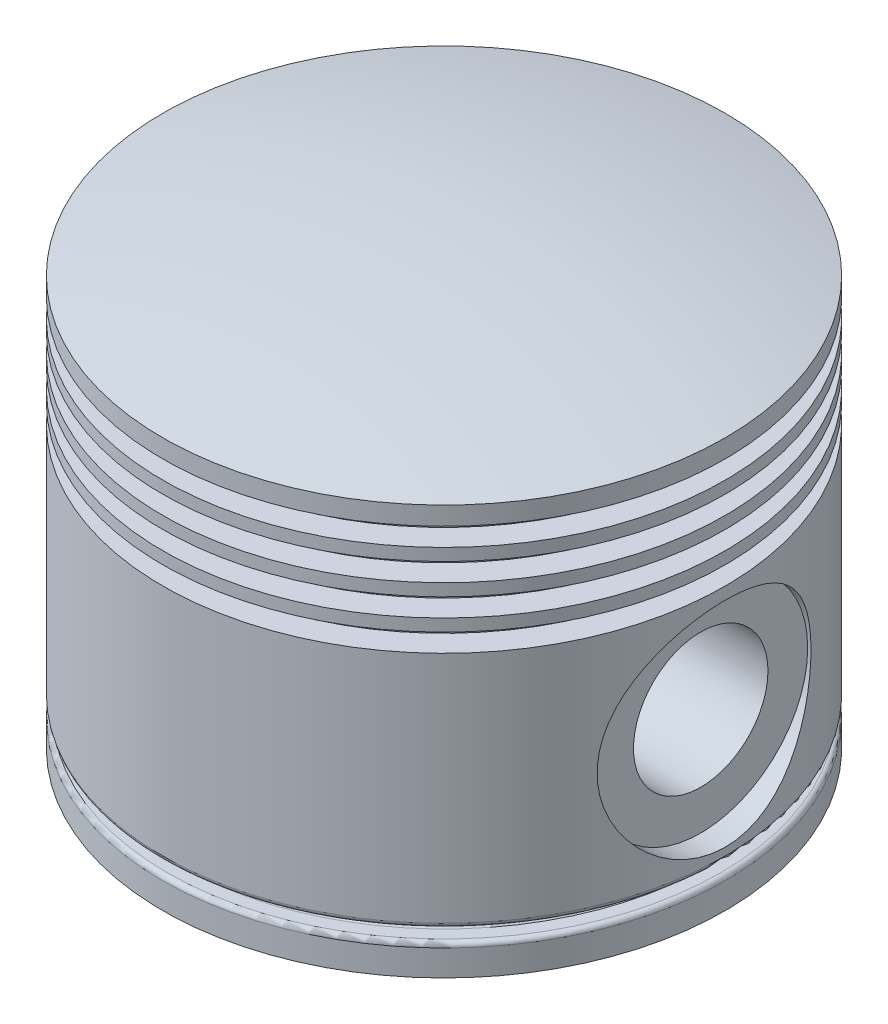
from build123d import *

# Parameters (mm, degrees)
BOSS_EXTRUDE1_REACH                       = 124.544
BOSS_EXTRUDE1_END_RADIUS                  = 37
BOSS_EXTRUDE1_START                       = 25
SKETCH5_R                                 = 19.5
CBORE_START                               = 25
CBORE_FOR_M5_HEX_HEAD_BOLT2_OUTLINE_R     = 11
CBORE_FOR_M5_HEX_HEAD_BOLT2_DEPTH         = 21.000000075
CBORE_START_2                             = 42
CBORE_FOR_M5_HEX_HEAD_BOLT2_2_OUTLINE_R   = 17.5
CBORE_FOR_M5_HEX_HEAD_BOLT2_2_OUTLINE_R_2 = 11
CBORE_FOR_M5_HEX_HEAD_BOLT2_2_DEPTH       = 4.000000075
FILLET1_R                                 = 0.75


# Read off the part's stored shape, not the designer's step: CBORE for M5 Hex Head Bolt2
with BuildPart() as part:
    # Sketch1 → Revolve1 (revolve)
    with BuildSketch(Plane.XY, mode=Mode.PRIVATE) as revolve1_sk:
        with BuildLine():
            Line((0, 72.683334091), (0, 62))
            Line((0, 62), (37, 62))
            Line((37, 62), (37, 0))
            Line((37, 0), (46, 0))
            Line((46, 0), (46, 5))
            Line((46, 5), (42.5, 5))
            Line((42.5, 5), (42.5, 7))
            Line((42.5, 7), (46, 7))
            Line((46, 7), (46, 46))
            Line((46, 46), (42, 46))
            Line((42, 46), (42, 49))
            Line((42, 49), (46, 49))
            Line((46, 49), (46, 51))
            Line((46, 51), (42, 51))
            Line((42, 51), (42, 54))
            Line((42, 54), (46, 54))
            Line((46, 54), (46, 56))
            Line((46, 56), (42, 56))
            Line((42, 56), (42, 59))
            Line((42, 59), (46, 59))
            Line((46, 59), (46, 61))
            Line((46, 61), (42, 61))
            Line((42, 61), (42, 64))
            Line((42, 64), (46, 64))
            Line((46, 64), (46, 67))
            ThreePointArc((46, 67), (23.174880185, 71.257119382), (0, 72.683334091))
        make_face()
    revolve(revolve1_sk.sketch.rotate(Axis((0, 0, 0), (0, 1, 0)), 90), axis=Axis((0, 0, 0), (0, 1, 0)))

    # Boss-Extrude1: up to this cylinder (the profile starts inside it)
    boss_extrude1_end = Plane(origin=(0, 26.5, 0), z_dir=(0, -1, 0)) * Cylinder(BOSS_EXTRUDE1_END_RADIUS, 324.088, mode=Mode.PRIVATE)
    # Sketch5 → Boss-Extrude1 (add, up to the surface)
    with BuildSketch(Plane(origin=(0, 0, 0), x_dir=(0, 0, -1), z_dir=(1, 0, 0)).offset(BOSS_EXTRUDE1_START), mode=Mode.PRIVATE) as boss_extrude1_sk1:
        with Locations(Location((0, 26.5, 0), (0, 0, 180))):
            Circle(SKETCH5_R)
    boss_extrude1_tool1 = extrude(boss_extrude1_sk1.sketch, amount=BOSS_EXTRUDE1_REACH, mode=Mode.PRIVATE) & boss_extrude1_end
    boss_extrude1 = boss_extrude1_tool1.solids().sort_by_distance((25, 26.5, 0))[0]
    add(boss_extrude1)

    # CBORE for M5 Hex Head Bolt2 outline → CBORE for M5 Hex Head Bolt2 (cut)
    with BuildSketch(Plane.YZ.offset(CBORE_START)):
        with Locations((26.5, 0)):
            Circle(CBORE_FOR_M5_HEX_HEAD_BOLT2_OUTLINE_R)
    cbore_for_m5_hex_head_bolt2 = extrude(amount=CBORE_FOR_M5_HEX_HEAD_BOLT2_DEPTH, mode=Mode.SUBTRACT)

    # CBORE for M5 Hex Head Bolt2 2 outline → CBORE for M5 Hex Head Bolt2 2 (cut)
    with BuildSketch(Plane.YZ.offset(CBORE_START_2)):
        with Locations((26.5, 0)):
            Circle(CBORE_FOR_M5_HEX_HEAD_BOLT2_2_OUTLINE_R)
        with Locations((26.5, 0)):
            Circle(CBORE_FOR_M5_HEX_HEAD_BOLT2_2_OUTLINE_R_2, mode=Mode.SUBTRACT)
    cbore_for_m5_hex_head_bolt2_2 = extrude(amount=CBORE_FOR_M5_HEX_HEAD_BOLT2_2_DEPTH, mode=Mode.SUBTRACT)

    # Mirror1: Boss-Extrude1, CBORE for M5 Hex Head Bolt2, CBORE for M5 Hex Head Bolt2 2 across plane
    add(boss_extrude1.mirror(Plane(origin=(0, 0, 0), x_dir=(0, 0, 1), z_dir=(1, 0, 0))))
    add(cbore_for_m5_hex_head_bolt2.mirror(Plane(origin=(0, 0, 0), x_dir=(0, 0, 1), z_dir=(1, 0, 0))), mode=Mode.SUBTRACT)
    add(cbore_for_m5_hex_head_bolt2_2.mirror(Plane(origin=(0, 0, 0), x_dir=(0, 0, 1), z_dir=(1, 0, 0))), mode=Mode.SUBTRACT)

    # Fillet1
    fillet1_edges = [part.edges().sort_by_distance(p)[0] for p in [
        (0, 7, 46),
        (0, 7, 42.5),
        (0, 5, 42.5),
        (0, 5, 46),
    ]]
    fillet(fillet1_edges, radius=FILLET1_R)


solid = part.part
